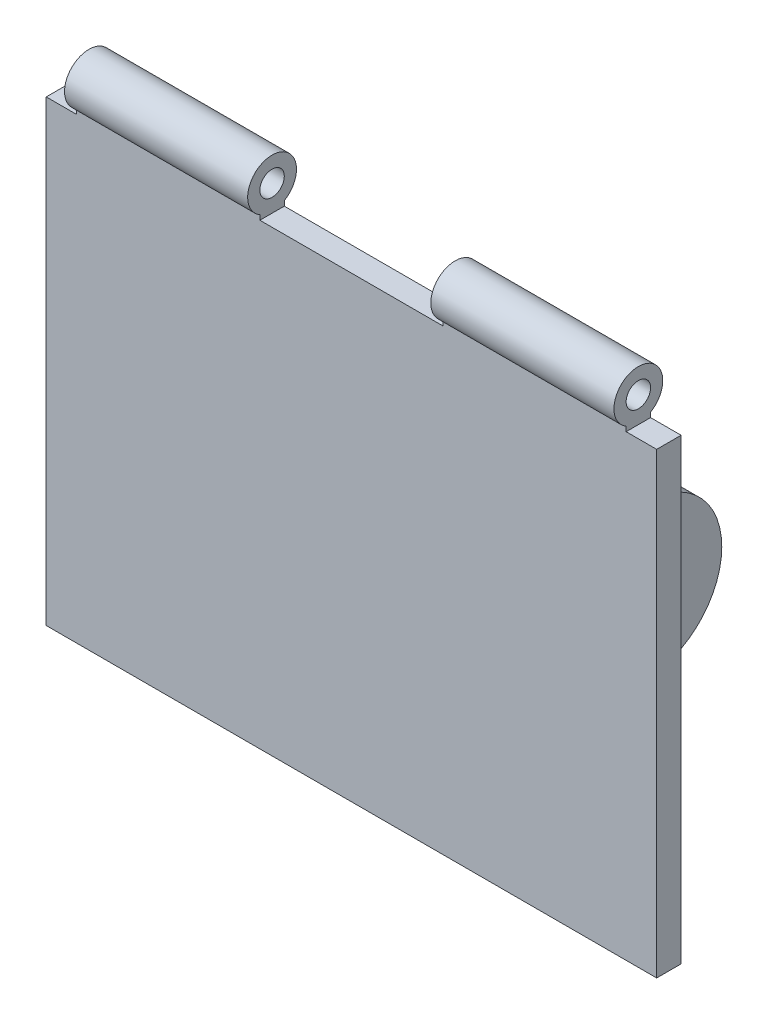
from build123d import *

# Parameters (mm, degrees)
SKETCH1_W           = 100
SKETCH1_H           = 75
BOSS_EXTRUDE1_DEPTH = 4
SKETCH2_R           = 2
BOSS_EXTRUDE2_DEPTH = 30
SKETCH3_W           = 50
SKETCH3_H           = 25
BOSS_EXTRUDE3_DEPTH = 6.665
CUT_EXTRUDE2_START  = -13.33
CUT_EXTRUDE2_DEPTH  = 13.33
SKETCH5_R           = 4.2
CUT_EXTRUDE3_DEPTH  = 89.340164846


# Read off the part's stored shape, not the designer's step: Cut-Extrude2
with BuildPart() as part:
    # Sketch1 → Boss-Extrude1 (new body)
    with BuildSketch(Plane.XY):
        Rectangle(SKETCH1_W, SKETCH1_H)
    extrude(amount=BOSS_EXTRUDE1_DEPTH)

    # Sketch2 → Boss-Extrude2 (add)
    with BuildSketch(Plane(origin=(45, 0, 0), x_dir=(0, 0, -1), z_dir=(1, 0, 0))):
        with BuildLine():
            Line((-4, 38.285898385), (-4, 37.428468659))
            Line((-4, 37.428468659), (0, 37.428468659))
            Line((0, 37.428468659), (0, 38.285898385))
            ThreePointArc((0, 38.285898385), (-2, 45.75), (-4, 38.285898385))
        make_face()
        with Locations((-2, 41.75)):
            Circle(SKETCH2_R, mode=Mode.SUBTRACT)
    boss_extrude2 = extrude(amount=-BOSS_EXTRUDE2_DEPTH)

    # Mirror1: Boss-Extrude2 across plane
    add(boss_extrude2.mirror(Plane.ZY))

    # Sketch3 → Boss-Extrude3 (add, symmetric)
    with BuildSketch(Plane.ZY):
        with Locations((-25, -25)):
            Rectangle(SKETCH3_W, SKETCH3_H)
    extrude(amount=BOSS_EXTRUDE3_DEPTH, both=True)

    # Cut-Extrude2 outline → Cut-Extrude2 (cut)
    with BuildSketch(Plane.ZY.offset(6.665).offset(CUT_EXTRUDE2_START)):
        with BuildLine():
            Line((-50, -37.5), (-38.919370818, -37.5))
            ThreePointArc((-38.919370818, -37.5), (-46.831015832, -33.352603885), (-50, -25.000804036))
            Line((-50, -25.000804036), (-50, -37.5))
        make_face()
        with BuildLine():
            Line((-50, -12.5), (-50, -25.000804036))
            ThreePointArc((-50, -25.000804036), (-46.826545708, -16.643964506), (-38.905994132, -12.5))
            Line((-38.905994132, -12.5), (-50, -12.5))
        make_face()
    extrude(amount=CUT_EXTRUDE2_DEPTH, mode=Mode.SUBTRACT)

    # Sketch5 → Cut-Extrude3 (cut, through all)
    with BuildSketch(Plane.ZY.offset(6.665)):
        with Locations((-37.41, -25.000804036)):
            Circle(SKETCH5_R)
    extrude(amount=-CUT_EXTRUDE3_DEPTH, mode=Mode.SUBTRACT)


solid = part.part
